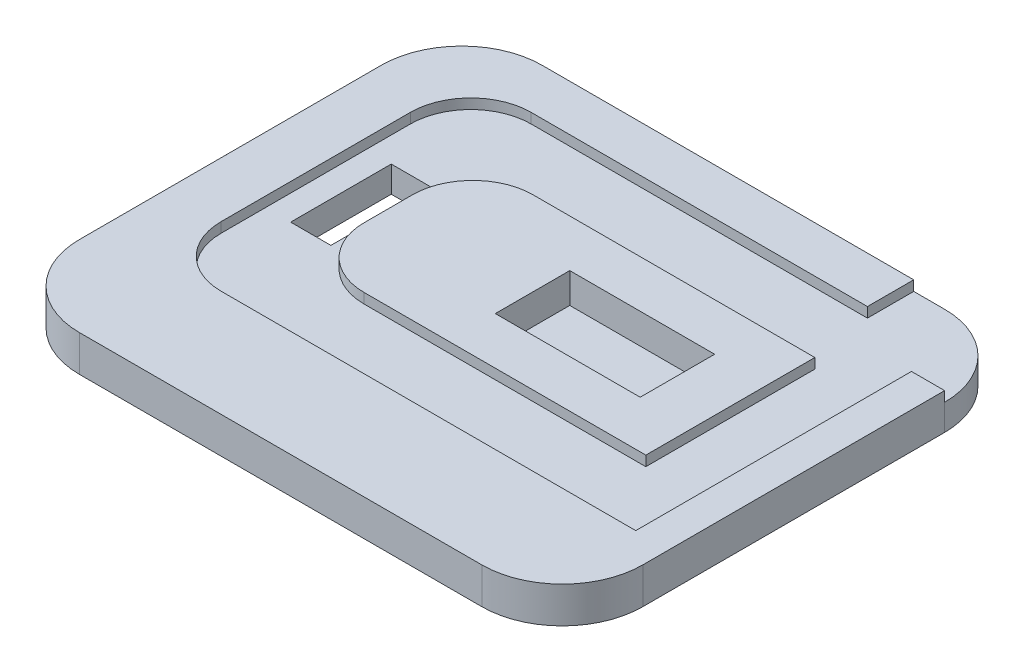
from build123d import *

# Parameters (mm, degrees)
SKETCH2_W           = 140
SKETCH2_H           = 115
BOSS_EXTRUDE1_DEPTH = 9
SKETCH3_W           = 10
SKETCH3_H           = 25
CUT_EXTRUDE1_DEPTH  = 104.469802358
FILLET1_R           = 20
SKETCH6_W           = 85
SKETCH6_H           = 42
CUT_EXTRUDE4_DEPTH  = 2.5
SKETCH7_W           = 36
SKETCH7_H           = 18.5
CUT_EXTRUDE5_DEPTH  = 7.5
FILLET2_R           = 15
SKETCH8_W           = 27.686667293
SKETCH8_H           = 20
CUT_EXTRUDE6_DEPTH  = 2.5


with BuildPart() as part:
    # Sketch2 → Boss-Extrude1 (new body)
    with BuildSketch(Plane(origin=(0, 0, 0), x_dir=(1, 0, 0), z_dir=(0, 1, 0))):
        with Locations((-10, -7.5)):
            Rectangle(SKETCH2_W, SKETCH2_H)
    extrude(amount=-BOSS_EXTRUDE1_DEPTH)

    # Sketch3 → Cut-Extrude1 (cut, through all)
    with BuildSketch(Plane(origin=(0, 0, 0), x_dir=(1, 0, 0), z_dir=(0, 1, 0))):
        with Locations((-55, 0)):
            Rectangle(SKETCH3_W, SKETCH3_H)
    extrude(amount=-CUT_EXTRUDE1_DEPTH, mode=Mode.SUBTRACT)

    # Fillet1
    fillet1_edges = [part.edges().sort_by_distance(p)[0] for p in [
        (60, -4.5, -50),
        (-80, -4.5, -50),
        (-80, -4.5, 65),
        (60, -4.5, 65),
    ]]
    fillet(fillet1_edges, radius=FILLET1_R)

    # Sketch6 → Cut-Extrude4 (cut)
    with BuildSketch(Plane(origin=(0, 0, 0), x_dir=(1, 0, 0), z_dir=(0, 1, 0))):
        Polygon((-66.25, 38.5), (51.75, 38.5), (51.75, 21), (51.75, -38.5), (-66.25, -38.5), align=None)
        with Locations((-5.75, 0)):
            Rectangle(SKETCH6_W, SKETCH6_H, mode=Mode.SUBTRACT)
    extrude(amount=-CUT_EXTRUDE4_DEPTH, mode=Mode.SUBTRACT)

    # Sketch7 → Cut-Extrude5 (cut)
    with BuildSketch(Plane(origin=(0, 0, 0), x_dir=(1, 0, 0), z_dir=(0, 1, 0))):
        with Locations((5.6, 0)):
            Rectangle(SKETCH7_W, SKETCH7_H)
    extrude(amount=-CUT_EXTRUDE5_DEPTH, mode=Mode.SUBTRACT)

    # Fillet2
    fillet2_edges = [part.edges().sort_by_distance(p)[0] for p in [
        (-66.25, -1.25, 38.5),
        (-66.25, -1.25, -38.5),
        (-48.25, -1.25, -21),
        (-48.25, -1.25, 21),
    ]]
    fillet(fillet2_edges, radius=FILLET2_R)

    # Sketch8 → Cut-Extrude6 (cut)
    with BuildSketch(Plane(origin=(0, 0, 0), x_dir=(1, 0, 0), z_dir=(0, 1, 0))):
        with Locations((46.156666354, 40)):
            Rectangle(SKETCH8_W, SKETCH8_H)
    extrude(amount=-CUT_EXTRUDE6_DEPTH, mode=Mode.SUBTRACT)


solid = part.part
